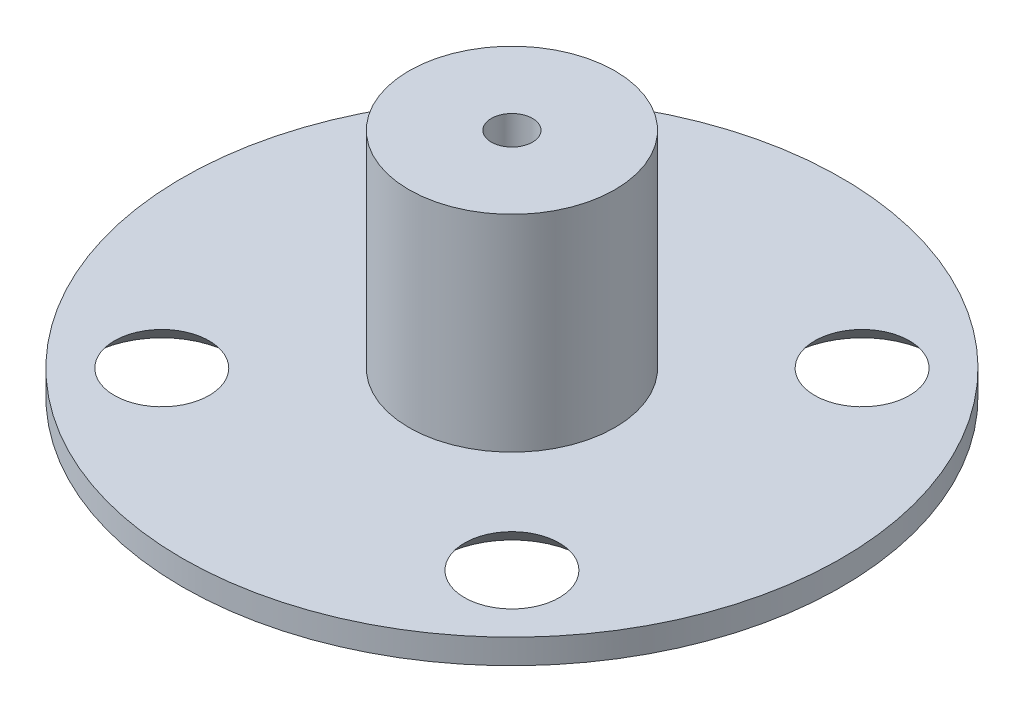
from build123d import *

# Parameters (mm, degrees)
ESQUISSE1_R             = 8
ESQUISSE1_R_2           = 1
BOSS_EXTRU_1_DEPTH      = 0.6
ESQUISSE2_R             = 2.5
BOSS_EXTRU_2_DEPTH      = 5
ESQUISSE3_R             = 0.5
ENL_V_MAT_EXTRU_1_DEPTH = 5.6
CHANFREIN1_SIZE         = 0.75


with BuildPart() as part:
    # Esquisse1 → Boss.-Extru.1 (new body)
    with BuildSketch(Plane(origin=(0, 0, 0), x_dir=(1, 0, 0), z_dir=(0, 1, 0))):
        with Locations(Location((0, 0, 0), (0, 0, 270))):
            Circle(ESQUISSE1_R)
        with Locations(Location((-4.25, 4.25, 0), (0, 0, 270))):
            Circle(ESQUISSE1_R_2, mode=Mode.SUBTRACT)
        with Locations(Location((4.25, 4.25, 0), (0, 0, 270))):
            Circle(ESQUISSE1_R_2, mode=Mode.SUBTRACT)
        with Locations(Location((4.25, -4.25, 0), (0, 0, 270))):
            Circle(ESQUISSE1_R_2, mode=Mode.SUBTRACT)
        with Locations(Location((-4.25, -4.25, 0), (0, 0, 270))):
            Circle(ESQUISSE1_R_2, mode=Mode.SUBTRACT)
    extrude(amount=BOSS_EXTRU_1_DEPTH)

    # Esquisse2 → Boss.-Extru.2 (add)
    with BuildSketch(Plane(origin=(0, 0.6, 0), x_dir=(1, 0, 0), z_dir=(0, 1, 0))):
        with Locations(Location((0, 0, 0), (0, 0, 270))):
            Circle(ESQUISSE2_R)
    extrude(amount=BOSS_EXTRU_2_DEPTH)

    # Esquisse3 → Enlèv. mat.-Extru.1 (cut)
    with BuildSketch(Plane(origin=(0, 5.6, 0), x_dir=(1, 0, 0), z_dir=(0, 1, 0))):
        with Locations(Location((0, 0, 0), (0, 0, 270))):
            Circle(ESQUISSE3_R)
    extrude(amount=-ENL_V_MAT_EXTRU_1_DEPTH, mode=Mode.SUBTRACT)

    # Chanfrein1
    # the kernel refuses this chamfer: 0.75 mm, written as the material it takes off along each edge
    with BuildSketch(Plane(origin=(4.25, 0, 4.25), x_dir=(0, 0, 1), z_dir=(-1, 0, 0))) as chanfrein1_piece_1:
        Polygon((1 + CHANFREIN1_SIZE, 0), (1, CHANFREIN1_SIZE), (1, 0), align=None)
    revolve(axis=Axis((4.25, 0, 4.25), (0, 1, 0)), mode=Mode.SUBTRACT)
    with BuildSketch(Plane(origin=(-4.25, 0, 4.25), x_dir=(0, 0, 1), z_dir=(-1, 0, 0))) as chanfrein1_piece_2:
        Polygon((1 + CHANFREIN1_SIZE, 0), (1, CHANFREIN1_SIZE), (1, 0), align=None)
    revolve(axis=Axis((-4.25, 0, 4.25), (0, 1, 0)), mode=Mode.SUBTRACT)
    with BuildSketch(Plane(origin=(-4.25, 0, -4.25), x_dir=(0, 0, 1), z_dir=(-1, 0, 0))) as chanfrein1_piece_3:
        Polygon((1 + CHANFREIN1_SIZE, 0), (1, CHANFREIN1_SIZE), (1, 0), align=None)
    revolve(axis=Axis((-4.25, 0, -4.25), (0, 1, 0)), mode=Mode.SUBTRACT)
    with BuildSketch(Plane(origin=(4.25, 0, -4.25), x_dir=(0, 0, 1), z_dir=(-1, 0, 0))) as chanfrein1_piece_4:
        Polygon((1 + CHANFREIN1_SIZE, 0), (1, CHANFREIN1_SIZE), (1, 0), align=None)
    revolve(axis=Axis((4.25, 0, -4.25), (0, 1, 0)), mode=Mode.SUBTRACT)


solid = part.part
